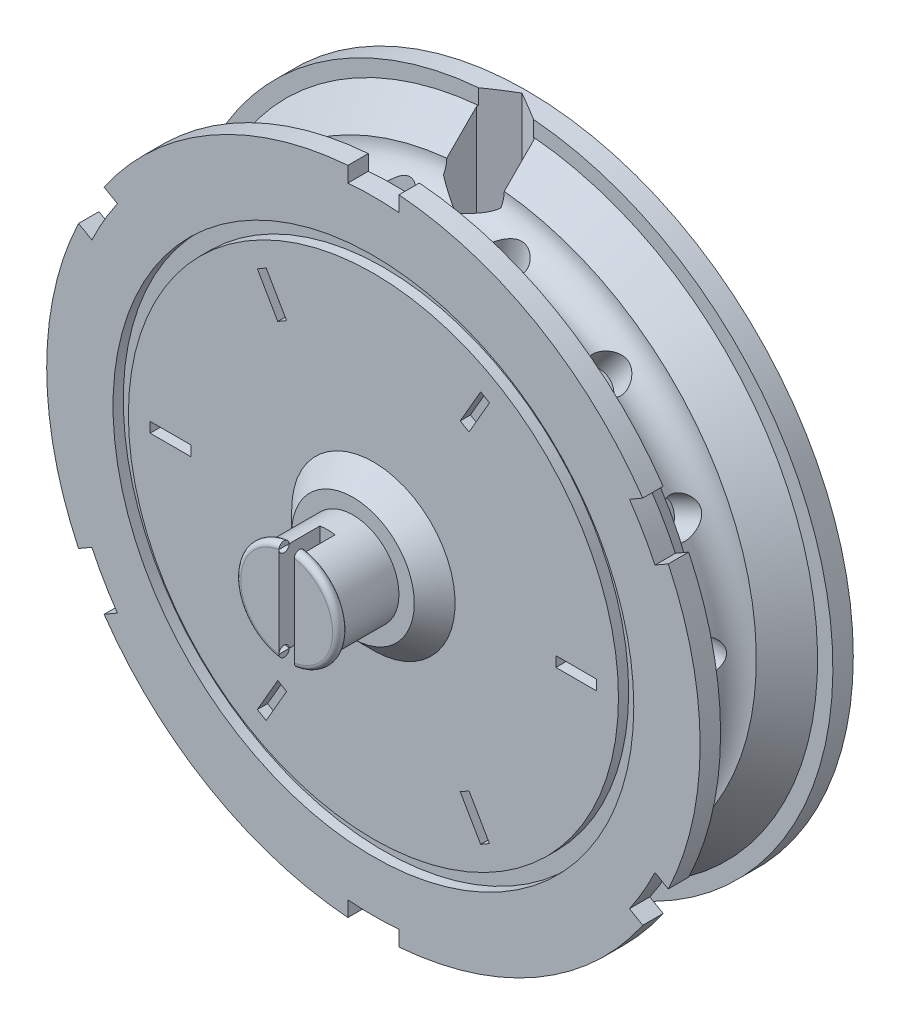
from build123d import *

# Parameters (mm, degrees)
SALIENTE_EXTRUIR1_DEPTH    = 7.7
CORTAR_EXTRUIR1_DEPTH      = 19.533842919
CORTAR_EXTRUIR1_DEPTH_BACK = 19.533842919
CROQUIS3_R                 = 1.65
CROQUIS5_R                 = 2.6
CORTAR_EXTRUIR2_DEPTH      = 48.357153631
CORTAR_EXTRUIR3_DEPTH      = 44.815408405
CROQUIS7_R                 = 6
SALIENTE_EXTRUIR2_DEPTH    = 2
CROQUIS8_R                 = 4.5
SALIENTE_EXTRUIR3_DEPTH    = 5.5
CHAFL_N1_SIZE              = 2
CROQUIS10_W                = 1.5
CROQUIS10_H                = 10
CORTAR_EXTRUIR6_DEPTH      = 4
CORTAR_EXTRUIR7_DEPTH      = 8
CROQUIS15_R                = 25.5
CROQUIS15_R_2              = 24
CORTAR_EXTRUIR8_DEPTH      = 1
CROQUIS16_R                = 1.75
CORTAR_EXTRUIR10_DEPTH     = 8
MATRIZC1_COUNT             = 14
CROQUIS17_W                = 4
CROQUIS17_H                = 1
CORTAR_EXTRUIR11_DEPTH     = 1
MATRIZC2_COUNT             = 6
SALIENTE_EXTRUIR4_START    = -2
CROQUIS18_R                = 32
CROQUIS18_R_2              = 30.5
SALIENTE_EXTRUIR4_DEPTH    = 2
CROQUIS19_R                = 32
CROQUIS19_R_2              = 30.5
SALIENTE_EXTRUIR5_DEPTH    = 2
CORTAR_EXTRUIR12_DEPTH     = 48.933704448
CORTAR_EXTRUIR13_DEPTH     = 2
MATRIZC3_COUNT             = 6
CROQUIS5_2_R               = 2.6
CORTAR_EXTRUIR14_DEPTH     = 52.334686345


with BuildPart() as part:
    # Croquis2 → Saliente-Extruir1 (new body)
    with BuildSketch(Plane.XY.offset(-7.7)):
        Polygon((-8.42931393, 0), (-4.214656965, -7.3), (4.214656965, -7.3), (8.42931393, 0), (4.214656965, 7.3), (-4.214656965, 7.3), align=None)
        Polygon((-3.059956427, -5.3), (3.059956427, -5.3), (6.119912853, 0), (3.059956427, 5.3), (-3.059956427, 5.3), (-6.119912853, 0), align=None, mode=Mode.SUBTRACT)
    extrude(amount=SALIENTE_EXTRUIR1_DEPTH)

    # Croquis3 → Cortar-Extruir1 (cut, two sides: drawn at the far end of the back side and taken through both)
    with BuildSketch(Plane.XZ.offset(7.3).offset(-CORTAR_EXTRUIR1_DEPTH_BACK)):
        with Locations(Location((0, -4, 0), (0, 0, 90))):
            Circle(CROQUIS3_R)
    extrude(amount=CORTAR_EXTRUIR1_DEPTH + CORTAR_EXTRUIR1_DEPTH_BACK, mode=Mode.SUBTRACT)

    # Croquis4 → Revolución1 (revolve)
    with BuildSketch(Plane(origin=(0, 0, 0), x_dir=(1, 0, 0), z_dir=(0, 1, 0)), mode=Mode.PRIVATE) as revoluci_n1_sk:
        with BuildLine():
            Line((0, 7.7), (0, -7.3))
            Line((0, -7.3), (30.5, -7.3))
            Line((30.5, -7.3), (30.5, -5.3))
            Line((30.5, -5.3), (27.5, -2.3))
            ThreePointArc((27.5, -2.3), (25, 0.2), (27.5, 2.7))
            Line((27.5, 2.7), (30.5, 5.7))
            Line((30.5, 5.7), (30.5, 7.7))
            Line((30.5, 7.7), (0, 7.7))
        make_face()
    revolve(revoluci_n1_sk.sketch.rotate(Axis((0, 0, -7.7), (0, 0, 1)), 180), axis=Axis((0, 0, -7.7), (0, 0, 1)))

    # Croquis5 → Cortar-Extruir2 (cut, through all)
    with BuildSketch(Plane(origin=(0, 4.9, 0), x_dir=(1, 0, 0), z_dir=(0, 1, 0))):
        with Locations(Location((0, 4, 0), (0, 0, 270))):
            Circle(CROQUIS5_R)
    extrude(amount=-CORTAR_EXTRUIR2_DEPTH, mode=Mode.SUBTRACT)

    # Croquis6 → Cortar-Extruir3 (cut, through all)
    with BuildSketch(Plane(origin=(0, 0, 0), x_dir=(1, 0, 0), z_dir=(0, 1, 0))):
        Polygon((0, 0.75), (2.814582562, 2.375), (2.814582562, 5.625), (0, 7.25), (-2.814582562, 5.625), (-2.814582562, 2.375), align=None)
    extrude(amount=CORTAR_EXTRUIR3_DEPTH, mode=Mode.SUBTRACT)

    # Croquis7 → Saliente-Extruir2 (add)
    with BuildSketch(Plane.XY.offset(7.3)):
        Circle(CROQUIS7_R)
    extrude(amount=SALIENTE_EXTRUIR2_DEPTH)

    # Croquis8 → Saliente-Extruir3 (add)
    with BuildSketch(Plane.XY.offset(9.3)):
        Circle(CROQUIS8_R)
    extrude(amount=SALIENTE_EXTRUIR3_DEPTH)

    # Chaflán1
    chafl_n1_edges = [part.edges().sort_by_distance(p)[0] for p in [
        (-6, 0, 7.3),
    ]]
    chamfer(chafl_n1_edges, length=CHAFL_N1_SIZE - 0.0001)  # a hair under: the kernel refuses the full size

    # Croquis9 → Revolución2 (revolve)
    with BuildSketch(Plane(origin=(0, 0, 0), x_dir=(1, 0, 0), z_dir=(0, 1, 0))):
        with BuildLine():
            Line((0, -14.8), (-4.5, -14.8))
            ThreePointArc((-4.5, -14.8), (-4.146446609, -14.946446609), (-4, -15.3))
            ThreePointArc((-4, -15.3), (-4.146446609, -15.653553391), (-4.5, -15.8))
            Line((-4.5, -15.8), (0, -15.8))
            Line((0, -15.8), (0, -14.8))
        make_face()
        with BuildLine():
            Line((-4.5, -15.3), (-4.5, -14.8))
            ThreePointArc((-4.5, -14.8), (-5, -15.3), (-4.5, -15.8))
            Line((-4.5, -15.8), (-4.5, -15.3))
        make_face()
    revolve(axis=Axis((0, 0, 14.8), (0, 0, 1)))

    # Croquis10 → Cortar-Extruir6 (cut)
    with BuildSketch(Plane.XY.offset(15.8)):
        Rectangle(CROQUIS10_W, CROQUIS10_H)
    extrude(amount=-CORTAR_EXTRUIR6_DEPTH, mode=Mode.SUBTRACT)

    # Croquis12 → Cortar-Extruir7 (cut)
    with BuildSketch(Plane(origin=(0, 0, -7.7), x_dir=(-1, 0, 0), z_dir=(0, 0, -1))):
        Polygon((6.119912853, 0), (3.059956427, 5.3), (-3.059956427, 5.3), (-6.119912853, 0), (-3.059956427, -5.3), (3.059956427, -5.3), align=None)
    extrude(amount=-CORTAR_EXTRUIR7_DEPTH, mode=Mode.SUBTRACT)

    # Croquis15 → Cortar-Extruir8 (cut)
    with BuildSketch(Plane.XY.offset(7.3)):
        Circle(CROQUIS15_R)
        Circle(CROQUIS15_R_2, mode=Mode.SUBTRACT)
    extrude(amount=-CORTAR_EXTRUIR8_DEPTH, mode=Mode.SUBTRACT)

    # Croquis16 → Cortar-Extruir10 (cut)
    with BuildSketch(Plane(origin=(30.5, 0, 0), x_dir=(0, 0, -1), z_dir=(1, 0, 0))):
        Circle(CROQUIS16_R)
    cortar_extruir10 = extrude(amount=-CORTAR_EXTRUIR10_DEPTH, mode=Mode.SUBTRACT)

    # MatrizC1: Cortar-Extruir10 ×14 about axis
    matrizc1_axis = Axis((0, 0, 0), (0, 0, 1))
    for i in range(1, MATRIZC1_COUNT):
        add(cortar_extruir10.rotate(matrizc1_axis, i * 360 / MATRIZC1_COUNT), mode=Mode.SUBTRACT)

    # Croquis17 → Cortar-Extruir11 (cut)
    with BuildSketch(Plane.XY.offset(7.3)):
        with Locations((19.870465208, 0)):
            Rectangle(CROQUIS17_W, CROQUIS17_H)
    cortar_extruir11 = extrude(amount=-CORTAR_EXTRUIR11_DEPTH, mode=Mode.SUBTRACT)

    # MatrizC2: Cortar-Extruir11 ×6 about axis
    matrizc2_axis = Axis((0, 0, 0), (0, 0, 1))
    for i in range(1, MATRIZC2_COUNT):
        add(cortar_extruir11.rotate(matrizc2_axis, i * 360 / MATRIZC2_COUNT), mode=Mode.SUBTRACT)

    # Croquis18 → Saliente-Extruir4 (add)
    with BuildSketch(Plane.XY.offset(7.3).offset(SALIENTE_EXTRUIR4_START)):
        Circle(CROQUIS18_R)
        with Locations(Location((0, 0, 0), (0, 0, 180))):
            Circle(CROQUIS18_R_2, mode=Mode.SUBTRACT)
    extrude(amount=SALIENTE_EXTRUIR4_DEPTH)

    # Croquis19 → Saliente-Extruir5 (add)
    with BuildSketch(Plane(origin=(0, 0, -7.7), x_dir=(-1, 0, 0), z_dir=(0, 0, -1))):
        with Locations(Location((0, 0, 0), (0, 0, 180))):
            Circle(CROQUIS19_R)
        Circle(CROQUIS19_R_2, mode=Mode.SUBTRACT)
    extrude(amount=-SALIENTE_EXTRUIR5_DEPTH)

    # Croquis6<3> → Cortar-Extruir12 (cut, through all)
    with BuildSketch(Plane(origin=(0, 0, 0), x_dir=(1, 0, 0), z_dir=(0, 1, 0))):
        Polygon((0, 0.75), (2.814582562, 2.375), (2.814582562, 5.625), (0, 7.25), (-2.814582562, 5.625), (-2.814582562, 2.375), align=None)
    extrude(amount=CORTAR_EXTRUIR12_DEPTH, mode=Mode.SUBTRACT)

    # Croquis20 → Cortar-Extruir13 (cut)
    with BuildSketch(Plane(origin=(0, 0, 5.3), x_dir=(-1, 0, 0), z_dir=(0, 0, -1))):
        with BuildLine():
            ThreePointArc((2.5, 31.902194282), (0, 32), (-2.5, 31.902194282))
            Line((-2.5, 31.902194282), (-2.5, 30.397368307))
            ThreePointArc((-2.5, 30.397368307), (0, 30.5), (2.5, 30.397368307))
            Line((2.5, 30.397368307), (2.5, 31.902194282))
        make_face()
    cortar_extruir13 = extrude(amount=-CORTAR_EXTRUIR13_DEPTH, mode=Mode.SUBTRACT)

    # MatrizC3: Cortar-Extruir13 ×6 about axis
    matrizc3_axis = Axis((0, 0, 0), (0, 0, 1))
    for i in range(1, MATRIZC3_COUNT):
        add(cortar_extruir13.rotate(matrizc3_axis, i * 360 / MATRIZC3_COUNT), mode=Mode.SUBTRACT)

    # Croquis5<2> → Cortar-Extruir14 (cut, through all)
    with BuildSketch(Plane(origin=(0, 4.9, 0), x_dir=(1, 0, 0), z_dir=(0, 1, 0))):
        with Locations(Location((0, 4, 0), (0, 0, 329.999995942))):
            Circle(CROQUIS5_2_R)
    extrude(amount=-CORTAR_EXTRUIR14_DEPTH, mode=Mode.SUBTRACT)


solid = part.part
